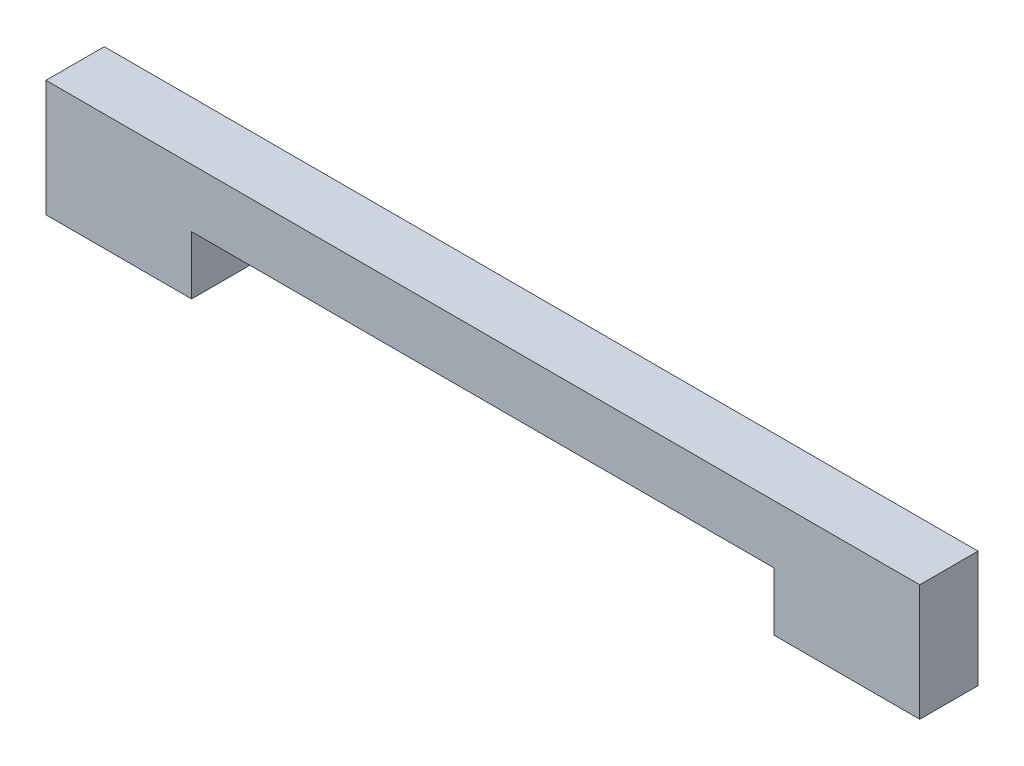
from build123d import *

# Parameters (mm, degrees)
BOSS_EXTRUDE1_DEPTH = 4


with BuildPart() as part:
    # Sketch1 → Boss-Extrude1 (new body)
    with BuildSketch(Plane.XY):
        Polygon((10, 11.160839161), (10, 15.160839161), (50, 15.160839161), (50, 11.160839161), (60, 11.160839161), (60, 15.160839161), (60, 19.160839161), (0, 19.160839161), (0, 11.160839161), align=None)
    extrude(amount=BOSS_EXTRUDE1_DEPTH)


solid = part.part
